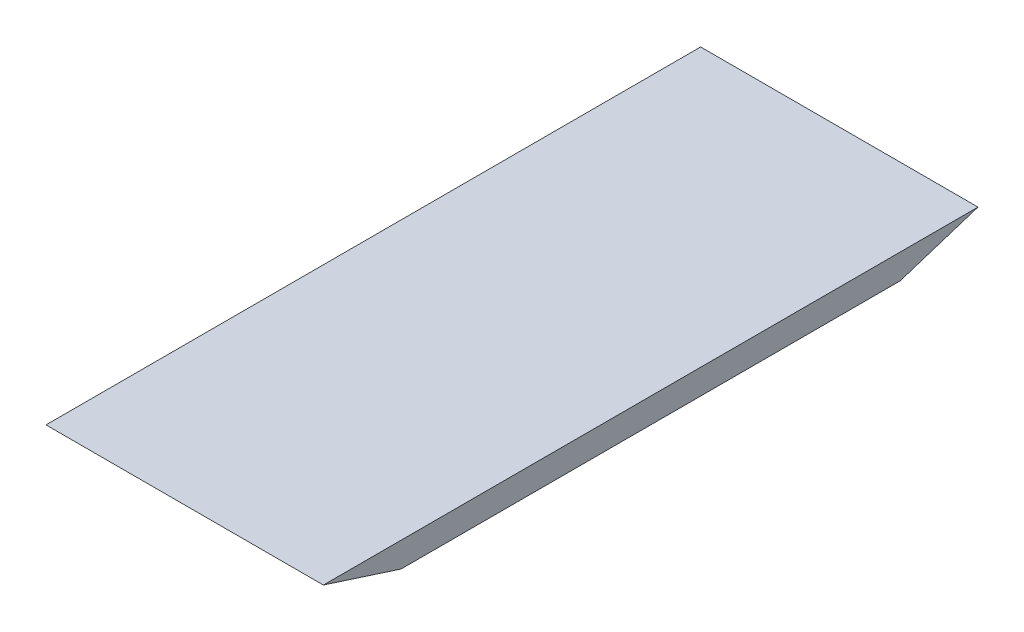
from build123d import *

# Parameters (mm, degrees)
BOSS_EXTRUDE1_DEPTH = 100


with BuildPart() as part:
    # Sketch1 → Boss-Extrude1 (new body)
    with BuildSketch(Plane(origin=(0, 0, 0), x_dir=(0, 0, -1), z_dir=(1, 0, 0))):
        Polygon((0, 0), (236, 0), (208, -9), (28, -9), align=None)
    extrude(amount=BOSS_EXTRUDE1_DEPTH)


solid = part.part
